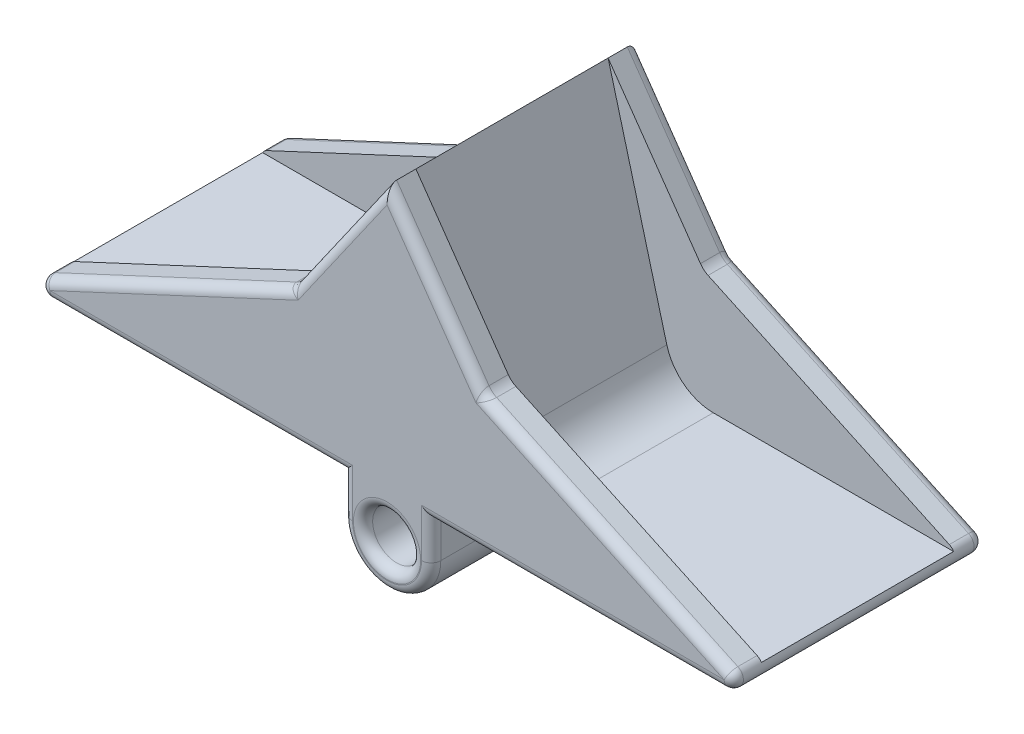
from build123d import *
from OCP.BRepAlgoAPI import BRepAlgoAPI_Cut
from OCP.TopTools import TopTools_ListOfShape

# Parameters (mm, degrees)
BOSS_EXTRUDE1_START = 54.459022
SKETCH1_R           = 3.175
BOSS_EXTRUDE1_DEPTH = 33.020001
CUT_EXTRUDE1_START  = 58.269023
CUT_EXTRUDE1_DEPTH  = 25.4
SKETCH4_R           = 3.048
CUT_EXTRUDE2_DEPTH  = 2.54
FILLET1_R           = 6.35
FILLET2_R           = 1.27
FILLET3_R           = 2.54


with BuildPart() as part:
    # Sketch1 → Boss-Extrude1 (new body)
    with BuildSketch(Plane.XY.offset(BOSS_EXTRUDE1_START)):
        with BuildLine():
            Line((-21.955663069, 32.913530589), (-66.405663069, 32.913530589))
            Line((-66.405663069, 32.913530589), (-28.719401239, 50.486923087))
            Line((-28.719401239, 50.486923087), (-16.12504308, 68.473530589))
            Line((-16.12504308, 68.473530589), (-3.530684921, 50.486923087))
            Line((-3.530684921, 50.486923087), (34.155576909, 32.913530589))
            Line((34.155576909, 32.913530589), (-10.294423091, 32.913530589))
            Line((-10.294423091, 32.913530589), (-10.294423091, 27.833530589))
            ThreePointArc((-10.294423091, 27.833530589), (-16.12504308, 22.002910599), (-21.955663069, 27.833530589))
            Line((-21.955663069, 27.833530589), (-21.955663069, 32.913530589))
        make_face()
        with Locations(Location((-16.12504308, 27.833530589, 0), (0, 0, 180))):
            Circle(SKETCH1_R, mode=Mode.SUBTRACT)
    extrude(amount=BOSS_EXTRUDE1_DEPTH)

    # Sketch2 → Cut-Extrude1 (cut)
    with BuildSketch(Plane.XY.offset(CUT_EXTRUDE1_START)):
        Polygon((-7.107213009, 34.818530589), (-16.12504308, 68.473530589), (-3.530684921, 50.486923087), (30.070291226, 34.818530589), align=None)
        Polygon((-25.142873151, 34.818530589), (-16.12504308, 68.473530589), (-28.719401239, 50.486923087), (-62.320377386, 34.818530589), align=None)
    extrude(amount=CUT_EXTRUDE1_DEPTH, mode=Mode.SUBTRACT)


with BuildPart() as cut_extrude2_tool:
    # Sketch4 → Cut-Extrude2 (new body)
    with BuildSketch(Plane(origin=(0, 0, 54.459022565), x_dir=(-1, 0, 0), z_dir=(0, 0, -1))):
        with Locations((16.12504308, 58.313530589)):
            Circle(SKETCH4_R)
    extrude(amount=-CUT_EXTRUDE2_DEPTH)


with BuildPart() as part_1:
    add(part.part)

    # Cut-Extrude2: cut by cut_extrude2_tool, with a tolerance
    cut_extrude2_stock = TopTools_ListOfShape()
    cut_extrude2_stock.Append(part_1.part.wrapped)
    cut_extrude2_tools = TopTools_ListOfShape()
    cut_extrude2_tools.Append(cut_extrude2_tool.part.wrapped)
    cut_extrude2_cut = BRepAlgoAPI_Cut()
    cut_extrude2_cut.SetArguments(cut_extrude2_stock)
    cut_extrude2_cut.SetTools(cut_extrude2_tools)
    cut_extrude2_cut.SetFuzzyValue(0.00001)
    cut_extrude2_cut.Build()
    add(Compound.cast(cut_extrude2_cut.Shape()).solids(), mode=Mode.REPLACE)

    # Fillet1
    fillet1_edges = [part_1.edges().sort_by_distance(p)[0] for p in [
        (-25.142873151, 34.818530589, 70.969023),
        (-7.107213009, 34.818530589, 70.969023),
    ]]
    fillet(fillet1_edges, radius=FILLET1_R)

    # Fillet2
    # the kernel refuses this fillet: 1.27 mm, written as the material it takes off along each edge
    with BuildSketch(Plane(origin=(28.42697711, 34.183530589, 55.729022), x_dir=(0.21643961393809957, 0.9762960071199341, 0), z_dir=(0.38783998848387446, -0.08598205540637287, -0.9177075947604028))) as fillet2_piece_1_section:
        Polygon((-7.204264304, -7.204264304), (7.204264304, -7.204264304), (7.204264304, 7.204264304), (-7.204264304, 7.204264304), align=None)
    fillet2_piece_1 = extrude(amount=7.204264304, mode=Mode.PRIVATE)
    fillet2_piece_1 = split(fillet2_piece_1, bisect_by=Plane(origin=(28.42697711, 34.183530589, 55.729022), z_dir=(1, 0, 0)), keep=Keep.TOP, mode=Mode.PRIVATE)
    fillet2_piece_1 = split(fillet2_piece_1, bisect_by=Plane(origin=(28.42697711, 34.183530589, 55.729022), z_dir=(0, 0, -1)), keep=Keep.TOP, mode=Mode.PRIVATE)
    fillet2_piece_1 = split(fillet2_piece_1, bisect_by=Plane(origin=(28.42697711, 34.183530589, 55.729022), z_dir=(0.9063077870366527, -0.42261826174069367, 0)), keep=Keep.TOP, mode=Mode.PRIVATE)
    fillet2_piece_1 = split(fillet2_piece_1, bisect_by=Plane(origin=(28.42697711, 34.183530589, 54.459022), z_dir=(0, 0, 1)), keep=Keep.TOP, mode=Mode.PRIVATE)
    fillet2_piece_1 = split(fillet2_piece_1, bisect_by=Plane(origin=(28.42697711, 32.913530589, 55.729022), z_dir=(0, 1, 0)), keep=Keep.TOP, mode=Mode.PRIVATE)
    fillet2_piece_1 = split(fillet2_piece_1, bisect_by=Plane(origin=(28.963702302, 35.334541478, 55.729022), z_dir=(-0.42261826174069367, -0.9063077870366527, 0)), keep=Keep.TOP, mode=Mode.PRIVATE)
    fillet2_piece_1 = fillet2_piece_1 - Plane(origin=(28.42697711, 34.183530589, 55.729022), x_dir=(-0.38783998848387446, 0.08598205540637287, 0.9177075947604028), z_dir=(0.21643961393809957, 0.9762960071199341, 0)) * Sphere(FILLET2_R, mode=Mode.PRIVATE)
    with BuildSketch(Plane(origin=(-60.67706327, 34.183530589, 55.729022), x_dir=(0.2164396139380998, -0.976296007119934, 0), z_dir=(-0.38783998848387446, -0.08598205540637296, -0.9177075947604028))) as fillet2_piece_2_section:
        Polygon((-7.204264304, -7.204264304), (7.204264304, -7.204264304), (7.204264304, 7.204264304), (-7.204264304, 7.204264304), align=None)
    fillet2_piece_2 = extrude(amount=7.204264304, mode=Mode.PRIVATE)
    fillet2_piece_2 = split(fillet2_piece_2, bisect_by=Plane(origin=(-60.67706327, 34.183530589, 55.729022), z_dir=(-1, 0, 0)), keep=Keep.TOP, mode=Mode.PRIVATE)
    fillet2_piece_2 = split(fillet2_piece_2, bisect_by=Plane(origin=(-60.67706327, 34.183530589, 55.729022), z_dir=(0, 0, -1)), keep=Keep.TOP, mode=Mode.PRIVATE)
    fillet2_piece_2 = split(fillet2_piece_2, bisect_by=Plane(origin=(-60.67706327, 34.183530589, 55.729022), z_dir=(-0.9063077870366526, -0.422618261740694, 0)), keep=Keep.TOP, mode=Mode.PRIVATE)
    fillet2_piece_2 = split(fillet2_piece_2, bisect_by=Plane(origin=(-60.67706327, 34.183530589, 54.459022), z_dir=(0, 0, 1)), keep=Keep.TOP, mode=Mode.PRIVATE)
    fillet2_piece_2 = split(fillet2_piece_2, bisect_by=Plane(origin=(-60.67706327, 32.913530589, 55.729022), z_dir=(0, 1, 0)), keep=Keep.TOP, mode=Mode.PRIVATE)
    fillet2_piece_2 = split(fillet2_piece_2, bisect_by=Plane(origin=(-61.213788462, 35.334541478, 55.729022), z_dir=(0.422618261740694, -0.9063077870366526, 0)), keep=Keep.TOP, mode=Mode.PRIVATE)
    fillet2_piece_2 = fillet2_piece_2 - Plane(origin=(-60.67706327, 34.183530589, 55.729022), x_dir=(0.38783998848387446, 0.08598205540637296, 0.9177075947604028), z_dir=(0.2164396139380998, -0.976296007119934, 0)) * Sphere(FILLET2_R, mode=Mode.PRIVATE)
    with BuildSketch(Plane(origin=(-60.67706327, 34.183530589, 86.209023), x_dir=(-0.2164396139380998, 0.976296007119934, 0), z_dir=(-0.38783998848387446, -0.08598205540637296, 0.9177075947604028))) as fillet2_piece_3_section:
        Polygon((-7.204264304, -7.204264304), (7.204264304, -7.204264304), (7.204264304, 7.204264304), (-7.204264304, 7.204264304), align=None)
    fillet2_piece_3 = extrude(amount=7.204264304, mode=Mode.PRIVATE)
    fillet2_piece_3 = split(fillet2_piece_3, bisect_by=Plane(origin=(-60.67706327, 34.183530589, 86.209023), z_dir=(-1, 0, 0)), keep=Keep.TOP, mode=Mode.PRIVATE)
    fillet2_piece_3 = split(fillet2_piece_3, bisect_by=Plane(origin=(-60.67706327, 34.183530589, 86.209023), z_dir=(0, 0, 1)), keep=Keep.TOP, mode=Mode.PRIVATE)
    fillet2_piece_3 = split(fillet2_piece_3, bisect_by=Plane(origin=(-60.67706327, 34.183530589, 86.209023), z_dir=(-0.9063077870366526, -0.422618261740694, 0)), keep=Keep.TOP, mode=Mode.PRIVATE)
    fillet2_piece_3 = split(fillet2_piece_3, bisect_by=Plane(origin=(-60.67706327, 34.183530589, 87.479023), z_dir=(0, 0, -1)), keep=Keep.TOP, mode=Mode.PRIVATE)
    fillet2_piece_3 = split(fillet2_piece_3, bisect_by=Plane(origin=(-60.67706327, 32.913530589, 86.209023), z_dir=(0, 1, 0)), keep=Keep.TOP, mode=Mode.PRIVATE)
    fillet2_piece_3 = split(fillet2_piece_3, bisect_by=Plane(origin=(-61.213788462, 35.334541478, 86.209023), z_dir=(0.422618261740694, -0.9063077870366526, 0)), keep=Keep.TOP, mode=Mode.PRIVATE)
    fillet2_piece_3 = fillet2_piece_3 - Plane(origin=(-60.67706327, 34.183530589, 86.209023), x_dir=(0.38783998848387446, 0.08598205540637296, -0.9177075947604028), z_dir=(-0.2164396139380998, 0.976296007119934, 0)) * Sphere(FILLET2_R, mode=Mode.PRIVATE)
    with BuildSketch(Plane(origin=(28.42697711, 34.183530589, 86.209023), x_dir=(0.9211187870387684, 0, -0.3892816206350206), z_dir=(0.38783998848387446, -0.08598205540637287, 0.9177075947604028))) as fillet2_piece_4_section:
        Polygon((-7.204264304, -7.204264304), (7.204264304, -7.204264304), (7.204264304, 7.204264304), (-7.204264304, 7.204264304), align=None)
    fillet2_piece_4 = extrude(amount=7.204264304, mode=Mode.PRIVATE)
    fillet2_piece_4 = split(fillet2_piece_4, bisect_by=Plane(origin=(28.42697711, 34.183530589, 86.209023), z_dir=(1, 0, 0)), keep=Keep.TOP, mode=Mode.PRIVATE)
    fillet2_piece_4 = split(fillet2_piece_4, bisect_by=Plane(origin=(28.42697711, 34.183530589, 86.209023), z_dir=(0.9063077870366527, -0.42261826174069367, 0)), keep=Keep.TOP, mode=Mode.PRIVATE)
    fillet2_piece_4 = split(fillet2_piece_4, bisect_by=Plane(origin=(28.42697711, 34.183530589, 86.209023), z_dir=(0, 0, 1)), keep=Keep.TOP, mode=Mode.PRIVATE)
    fillet2_piece_4 = split(fillet2_piece_4, bisect_by=Plane(origin=(28.42697711, 32.913530589, 86.209023), z_dir=(0, 1, 0)), keep=Keep.TOP, mode=Mode.PRIVATE)
    fillet2_piece_4 = split(fillet2_piece_4, bisect_by=Plane(origin=(28.42697711, 34.183530589, 87.479023), z_dir=(0, 0, -1)), keep=Keep.TOP, mode=Mode.PRIVATE)
    fillet2_piece_4 = split(fillet2_piece_4, bisect_by=Plane(origin=(28.963702302, 35.334541478, 86.209023), z_dir=(-0.42261826174069367, -0.9063077870366527, 0)), keep=Keep.TOP, mode=Mode.PRIVATE)
    fillet2_piece_4 = fillet2_piece_4 - Plane(origin=(28.42697711, 34.183530589, 86.209023), x_dir=(-0.38783998848387446, 0.08598205540637287, -0.9177075947604028), z_dir=(0.9211187870387684, 0, -0.3892816206350206)) * Sphere(FILLET2_R, mode=Mode.PRIVATE)
    with BuildSketch(Plane(origin=(-16.12504308, 27.833530589, 54.459022), x_dir=(-1, 0, 0), z_dir=(0, 1, 0))) as fillet2_piece_5:
        with BuildLine():
            CenterArc((3.175 + FILLET2_R, FILLET2_R), FILLET2_R, 180, 90)
            Line((3.175, FILLET2_R), (3.175, 0))
            Line((3.175, 0), (3.175 + FILLET2_R, 0))
        make_face()
    fillet2_piece_5_solid = revolve(axis=Axis((-16.12504308, 27.833530589, 54.459022), (0, 0, 1)), mode=Mode.PRIVATE)
    with BuildSketch(Plane(origin=(-10.294423091, 32.913530589, 54.459022), x_dir=(-1, 0, 0), z_dir=(0, -1, 0)), Plane(origin=(-21.955663069, 27.833530589, 54.459022), x_dir=(1, 0, 0), z_dir=(0, 1, 0))) as fillet2_piece_6:
        with BuildLine():
            CenterArc((FILLET2_R, -FILLET2_R), FILLET2_R, 90, 90)
            Line((0, -FILLET2_R), (0, 0))
            Line((0, 0), (FILLET2_R, 0))
        make_face()
    fillet2_piece_6_solid = extrude(amount=5.08, mode=Mode.PRIVATE)
    with BuildSketch(Plane(origin=(28.42697711, 32.913530589, 54.459022), x_dir=(0, 1, 0), z_dir=(-1, 0, 0)), Plane(origin=(-21.955663069, 32.913530589, 54.459022), x_dir=(0, 1, 0), z_dir=(-1, 0, 0))) as fillet2_piece_7:
        with BuildLine():
            CenterArc((FILLET2_R, -FILLET2_R), FILLET2_R, 90, 90)
            Line((0, -FILLET2_R), (0, 0))
            Line((0, 0), (FILLET2_R, 0))
        make_face()
    fillet2_piece_7_solid = extrude(amount=38.7214002, mode=Mode.PRIVATE)
    with BuildSketch(Plane(origin=(-6.408212144, 51.828736068, 54.459022), x_dir=(-0.42261826174069367, -0.9063077870366527, 0), z_dir=(0.9063077870366527, -0.42261826174069367, 0))) as fillet2_piece_8_section:
        with BuildLine():
            CenterArc((FILLET2_R, -FILLET2_R), FILLET2_R, 90, 90)
            Line((0, -FILLET2_R), (0, 0))
            Line((0, 0), (FILLET2_R, 0))
        make_face()
    fillet2_piece_8 = extrude(amount=39.028589352, mode=Mode.PRIVATE)
    fillet2_piece_8 = split(fillet2_piece_8, bisect_by=Plane(origin=(-5.107808274, 52.739288661, 54.459022), z_dir=(0.819152044288989, 0.5735764363510499, 0)), keep=Keep.TOP, mode=Mode.PRIVATE)
    with BuildSketch(Plane(origin=(-17.946148265, 71.074338329, 54.459022), x_dir=(-0.8191520442889889, -0.57357643635105, 0), z_dir=(0.57357643635105, -0.8191520442889891, 0))) as fillet2_piece_9_section:
        with BuildLine():
            CenterArc((FILLET2_R, -FILLET2_R), FILLET2_R, 90, 90)
            Line((0, -FILLET2_R), (0, 0))
            Line((0, 0), (FILLET2_R, 0))
        make_face()
    fillet2_piece_9 = extrude(amount=28.307593376, mode=Mode.PRIVATE)
    fillet2_piece_9 = split(fillet2_piece_9, bisect_by=Plane(origin=(-23.256894728, 59.685405787, 54.459022), z_dir=(0.42261826174069367, 0.9063077870366527, 0)), keep=Keep.TOP, mode=Mode.PRIVATE)
    with BuildSketch(Plane(origin=(-30.540506425, 47.886115346, 54.459022), x_dir=(0, 0, 1), z_dir=(0.5735764363510499, 0.8191520442889892, 0))) as fillet2_piece_10_section:
        with BuildLine():
            CenterArc((FILLET2_R, FILLET2_R), FILLET2_R, 180, 90)
            Line((0, FILLET2_R), (0, 0))
            Line((0, 0), (FILLET2_R, 0))
        make_face()
    fillet2_piece_10 = extrude(amount=28.307593376, mode=Mode.PRIVATE)
    fillet2_piece_10 = split(fillet2_piece_10, bisect_by=Plane(origin=(-31.211412915, 49.324878958, 54.459022), z_dir=(-0.422618261740694, 0.9063077870366526, 0)), keep=Keep.TOP, mode=Mode.PRIVATE)
    with BuildSketch(Plane(origin=(-61.213788462, 35.334541478, 54.459022), x_dir=(0, 0, 1), z_dir=(0.9063077870366526, 0.422618261740694, 0))) as fillet2_piece_11_section:
        with BuildLine():
            CenterArc((FILLET2_R, FILLET2_R), FILLET2_R, 180, 90)
            Line((0, FILLET2_R), (0, 0))
            Line((0, 0), (FILLET2_R, 0))
        make_face()
    fillet2_piece_11 = extrude(amount=39.028589352, mode=Mode.PRIVATE)
    fillet2_piece_11 = split(fillet2_piece_11, bisect_by=Plane(origin=(-46.529017956, 25.052154473, 54.459022), z_dir=(-0.8191520442889892, 0.5735764363510499, 0)), keep=Keep.TOP, mode=Mode.PRIVATE)
    with BuildSketch(Plane(origin=(-16.12504308, 27.833530589, 54.459022), x_dir=(1, 0, 0), z_dir=(0, 1, 0))) as fillet2_piece_12:
        with BuildLine():
            CenterArc((5.830619989 - FILLET2_R, -FILLET2_R), FILLET2_R, 0, 90)
            Line((5.830619989, -FILLET2_R), (5.830619989, 0))
            Line((5.830619989, 0), (5.830619989 - FILLET2_R, 0))
        make_face()
    fillet2_piece_12_solid = revolve(axis=Axis((-16.12504308, 27.833530589, 54.459022), (0, 0, -1)), revolution_arc=180, mode=Mode.PRIVATE)
    with BuildSketch(Plane(origin=(-21.955663069, 32.913530589, 87.479023), x_dir=(0, 1, 0), z_dir=(-1, 0, 0)), Plane(origin=(28.42697711, 32.913530589, 87.479023), x_dir=(0, 1, 0), z_dir=(-1, 0, 0))) as fillet2_piece_13:
        with BuildLine():
            CenterArc((FILLET2_R, FILLET2_R), FILLET2_R, 180, 90)
            Line((0, FILLET2_R), (0, 0))
            Line((0, 0), (FILLET2_R, 0))
        make_face()
    fillet2_piece_13_solid = extrude(amount=38.7214002, mode=Mode.PRIVATE)
    with BuildSketch(Plane(origin=(-61.213788462, 35.334541478, 87.479023), x_dir=(0, 0, -1), z_dir=(0.9063077870366526, 0.422618261740694, 0))) as fillet2_piece_14_section:
        with BuildLine():
            CenterArc((FILLET2_R, -FILLET2_R), FILLET2_R, 90, 90)
            Line((0, -FILLET2_R), (0, 0))
            Line((0, 0), (FILLET2_R, 0))
        make_face()
    fillet2_piece_14 = extrude(amount=39.028589352, mode=Mode.PRIVATE)
    fillet2_piece_14 = split(fillet2_piece_14, bisect_by=Plane(origin=(-46.529017956, 25.052154473, 87.479023), z_dir=(-0.8191520442889892, 0.5735764363510499, 0)), keep=Keep.TOP, mode=Mode.PRIVATE)
    with BuildSketch(Plane(origin=(-30.540506425, 47.886115346, 87.479023), x_dir=(0, 0, -1), z_dir=(0.5735764363510499, 0.8191520442889892, 0))) as fillet2_piece_15_section:
        with BuildLine():
            CenterArc((FILLET2_R, -FILLET2_R), FILLET2_R, 90, 90)
            Line((0, -FILLET2_R), (0, 0))
            Line((0, 0), (FILLET2_R, 0))
        make_face()
    fillet2_piece_15 = extrude(amount=28.307593376, mode=Mode.PRIVATE)
    fillet2_piece_15 = split(fillet2_piece_15, bisect_by=Plane(origin=(-31.211412915, 49.324878958, 87.479023), z_dir=(-0.422618261740694, 0.9063077870366526, 0)), keep=Keep.TOP, mode=Mode.PRIVATE)
    with BuildSketch(Plane(origin=(-17.946148265, 71.074338329, 87.479023), x_dir=(-0.819152044288989, -0.5735764363510499, 0), z_dir=(0.57357643635105, -0.8191520442889891, 0))) as fillet2_piece_16_section:
        with BuildLine():
            CenterArc((FILLET2_R, FILLET2_R), FILLET2_R, 180, 90)
            Line((0, FILLET2_R), (0, 0))
            Line((0, 0), (FILLET2_R, 0))
        make_face()
    fillet2_piece_16 = extrude(amount=28.307593376, mode=Mode.PRIVATE)
    fillet2_piece_16 = split(fillet2_piece_16, bisect_by=Plane(origin=(-23.256894728, 59.685405787, 87.479023), z_dir=(0.42261826174069367, 0.9063077870366527, 0)), keep=Keep.TOP, mode=Mode.PRIVATE)
    with BuildSketch(Plane(origin=(-6.408212144, 51.828736068, 87.479023), x_dir=(-0.42261826174069367, -0.9063077870366527, 0), z_dir=(0.9063077870366527, -0.42261826174069367, 0))) as fillet2_piece_17_section:
        with BuildLine():
            CenterArc((FILLET2_R, FILLET2_R), FILLET2_R, 180, 90)
            Line((0, FILLET2_R), (0, 0))
            Line((0, 0), (FILLET2_R, 0))
        make_face()
    fillet2_piece_17 = extrude(amount=39.028589352, mode=Mode.PRIVATE)
    fillet2_piece_17 = split(fillet2_piece_17, bisect_by=Plane(origin=(-5.107808274, 52.739288661, 87.479023), z_dir=(0.819152044288989, 0.5735764363510499, 0)), keep=Keep.TOP, mode=Mode.PRIVATE)
    with BuildSketch(Plane(origin=(-10.294423091, 32.913530589, 87.479023), x_dir=(-1, 0, 0), z_dir=(0, -1, 0)), Plane(origin=(-21.955663069, 27.833530589, 87.479023), x_dir=(1, 0, 0), z_dir=(0, 1, 0))) as fillet2_piece_18:
        with BuildLine():
            CenterArc((FILLET2_R, FILLET2_R), FILLET2_R, 180, 90)
            Line((0, FILLET2_R), (0, 0))
            Line((0, 0), (FILLET2_R, 0))
        make_face()
    fillet2_piece_18_solid = extrude(amount=5.08, mode=Mode.PRIVATE)
    with BuildSketch(Plane(origin=(-16.12504308, 27.833530589, 87.479023), x_dir=(1, 0, 0), z_dir=(0, 1, 0))) as fillet2_piece_19:
        with BuildLine():
            CenterArc((5.830619989 - FILLET2_R, FILLET2_R), FILLET2_R, 270, 90)
            Line((5.830619989, FILLET2_R), (5.830619989, 0))
            Line((5.830619989, 0), (5.830619989 - FILLET2_R, 0))
        make_face()
    fillet2_piece_19_solid = revolve(axis=Axis((-16.12504308, 27.833530589, 87.479023), (0, 0, -1)), revolution_arc=180, mode=Mode.PRIVATE)
    with BuildSketch(Plane(origin=(-16.12504308, 27.833530589, 87.479023), x_dir=(-1, 0, 0), z_dir=(0, 1, 0))) as fillet2_piece_20:
        with BuildLine():
            CenterArc((3.175 + FILLET2_R, -FILLET2_R), FILLET2_R, 90, 90)
            Line((3.175, -FILLET2_R), (3.175, 0))
            Line((3.175, 0), (3.175 + FILLET2_R, 0))
        make_face()
    fillet2_piece_20_solid = revolve(axis=Axis((-16.12504308, 27.833530589, 87.479023), (0, 0, 1)), mode=Mode.PRIVATE)
    with BuildSketch(Plane(origin=(34.155576909, 32.913530589, 55.729022), x_dir=(-1, 0, 0), z_dir=(0, 0, 1)), Plane(origin=(-66.405663069, 32.913530589, 55.729022), x_dir=(0.9063077870366528, 0.4226182617406935, 0), z_dir=(0, 0, 1))) as fillet2_piece_21:
        with BuildLine():
            CenterArc((FILLET2_R * 4.51070850366, -FILLET2_R), FILLET2_R, 90, 155)
            Line((FILLET2_R * 4.08809024192, -FILLET2_R * 1.90630778704), (0, 0))
            Line((0, 0), (FILLET2_R * 4.51070850366, 0))
        make_face()
    fillet2_piece_21_solid = extrude(amount=30.480001, mode=Mode.PRIVATE)
    with BuildSketch(Plane(origin=(-10.294423091, 36.088530589, 54.459022), x_dir=(-1, 0, 0), z_dir=(0, -1, 0))) as fillet2_piece_22a_section:
        with BuildLine():
            CenterArc((FILLET2_R, -FILLET2_R), FILLET2_R, 90, 90)
            Line((0, -FILLET2_R), (0, 0))
            Line((0, 0), (FILLET2_R, 0))
        make_face()
    fillet2_piece_22a = extrude(amount=8.255, mode=Mode.PRIVATE)
    fillet2_piece_22a = split(fillet2_piece_22a, bisect_by=Plane(origin=(-10.294423091, 32.913530589, 54.459022), z_dir=(0, 1, 0)), keep=Keep.TOP, mode=Mode.PRIVATE)
    with BuildSketch(Plane(origin=(28.42697711, 32.913530589, 54.459022), x_dir=(0, 1, 0), z_dir=(-1, 0, 0))) as fillet2_piece_22b_section:
        with BuildLine():
            CenterArc((FILLET2_R, -FILLET2_R), FILLET2_R, 90, 90)
            Line((0, -FILLET2_R), (0, 0))
            Line((0, 0), (FILLET2_R, 0))
        make_face()
    fillet2_piece_22b = extrude(amount=41.8964002, mode=Mode.PRIVATE)
    fillet2_piece_22b = split(fillet2_piece_22b, bisect_by=Plane(origin=(-10.294423091, 32.913530589, 54.459022), z_dir=(-1, 0, 0)), keep=Keep.TOP, mode=Mode.PRIVATE)
    fillet2_piece_22 = fillet2_piece_22a & fillet2_piece_22b
    with BuildSketch(Plane(origin=(-17.946148265, 71.074338329, 54.459022), x_dir=(-0.8191520442889889, -0.57357643635105, 0), z_dir=(0.57357643635105, -0.8191520442889891, 0))) as fillet2_piece_23a_section:
        with BuildLine():
            CenterArc((FILLET2_R, -FILLET2_R), FILLET2_R, 90, 90)
            Line((0, -FILLET2_R), (0, 0))
            Line((0, 0), (FILLET2_R, 0))
        make_face()
    fillet2_piece_23a = extrude(amount=28.307593376, mode=Mode.PRIVATE)
    fillet2_piece_23a = split(fillet2_piece_23a, bisect_by=Plane(origin=(-23.256894728, 59.685405787, 54.459022), z_dir=(-0.42261826174069367, -0.9063077870366527, 0)), keep=Keep.TOP, mode=Mode.PRIVATE)
    with BuildSketch(Plane(origin=(-6.408212144, 51.828736068, 54.459022), x_dir=(-0.42261826174069367, -0.9063077870366527, 0), z_dir=(0.9063077870366527, -0.42261826174069367, 0))) as fillet2_piece_23b_section:
        with BuildLine():
            CenterArc((FILLET2_R, -FILLET2_R), FILLET2_R, 90, 90)
            Line((0, -FILLET2_R), (0, 0))
            Line((0, 0), (FILLET2_R, 0))
        make_face()
    fillet2_piece_23b = extrude(amount=39.028589352, mode=Mode.PRIVATE)
    fillet2_piece_23b = split(fillet2_piece_23b, bisect_by=Plane(origin=(-5.107808274, 52.739288661, 54.459022), z_dir=(-0.819152044288989, -0.5735764363510499, 0)), keep=Keep.TOP, mode=Mode.PRIVATE)
    fillet2_piece_23 = fillet2_piece_23a & fillet2_piece_23b
    with BuildSketch(Plane(origin=(-30.540506425, 47.886115346, 54.459022), x_dir=(0, 0, 1), z_dir=(0.5735764363510499, 0.8191520442889892, 0))) as fillet2_piece_24a_section:
        with BuildLine():
            CenterArc((FILLET2_R, FILLET2_R), FILLET2_R, 180, 90)
            Line((0, FILLET2_R), (0, 0))
            Line((0, 0), (FILLET2_R, 0))
        make_face()
    fillet2_piece_24a = extrude(amount=28.307593376, mode=Mode.PRIVATE)
    fillet2_piece_24a = split(fillet2_piece_24a, bisect_by=Plane(origin=(-31.211412915, 49.324878958, 54.459022), z_dir=(0.422618261740694, -0.9063077870366526, 0)), keep=Keep.TOP, mode=Mode.PRIVATE)
    with BuildSketch(Plane(origin=(-61.213788462, 35.334541478, 54.459022), x_dir=(0, 0, 1), z_dir=(0.9063077870366526, 0.422618261740694, 0))) as fillet2_piece_24b_section:
        with BuildLine():
            CenterArc((FILLET2_R, FILLET2_R), FILLET2_R, 180, 90)
            Line((0, FILLET2_R), (0, 0))
            Line((0, 0), (FILLET2_R, 0))
        make_face()
    fillet2_piece_24b = extrude(amount=39.028589352, mode=Mode.PRIVATE)
    fillet2_piece_24b = split(fillet2_piece_24b, bisect_by=Plane(origin=(-46.529017956, 25.052154473, 54.459022), z_dir=(0.8191520442889892, -0.5735764363510499, 0)), keep=Keep.TOP, mode=Mode.PRIVATE)
    fillet2_piece_24 = fillet2_piece_24a & fillet2_piece_24b
    with BuildSketch(Plane(origin=(-18.780663069, 32.913530589, 54.459022), x_dir=(0, 1, 0), z_dir=(-1, 0, 0))) as fillet2_piece_25a_section:
        with BuildLine():
            CenterArc((FILLET2_R, -FILLET2_R), FILLET2_R, 90, 90)
            Line((0, -FILLET2_R), (0, 0))
            Line((0, 0), (FILLET2_R, 0))
        make_face()
    fillet2_piece_25a = extrude(amount=41.8964002, mode=Mode.PRIVATE)
    fillet2_piece_25a = split(fillet2_piece_25a, bisect_by=Plane(origin=(-21.955663069, 32.913530589, 54.459022), z_dir=(1, 0, 0)), keep=Keep.TOP, mode=Mode.PRIVATE)
    with BuildSketch(Plane(origin=(-21.955663069, 27.833530589, 54.459022), x_dir=(1, 0, 0), z_dir=(0, 1, 0))) as fillet2_piece_25b_section:
        with BuildLine():
            CenterArc((FILLET2_R, -FILLET2_R), FILLET2_R, 90, 90)
            Line((0, -FILLET2_R), (0, 0))
            Line((0, 0), (FILLET2_R, 0))
        make_face()
    fillet2_piece_25b = extrude(amount=8.255, mode=Mode.PRIVATE)
    fillet2_piece_25b = split(fillet2_piece_25b, bisect_by=Plane(origin=(-21.955663069, 32.913530589, 54.459022), z_dir=(0, 1, 0)), keep=Keep.TOP, mode=Mode.PRIVATE)
    fillet2_piece_25 = fillet2_piece_25a & fillet2_piece_25b
    with BuildSketch(Plane(origin=(-18.780663069, 32.913530589, 87.479023), x_dir=(0, 1, 0), z_dir=(-1, 0, 0))) as fillet2_piece_26a_section:
        with BuildLine():
            CenterArc((FILLET2_R, FILLET2_R), FILLET2_R, 180, 90)
            Line((0, FILLET2_R), (0, 0))
            Line((0, 0), (FILLET2_R, 0))
        make_face()
    fillet2_piece_26a = extrude(amount=41.8964002, mode=Mode.PRIVATE)
    fillet2_piece_26a = split(fillet2_piece_26a, bisect_by=Plane(origin=(-21.955663069, 32.913530589, 87.479023), z_dir=(1, 0, 0)), keep=Keep.TOP, mode=Mode.PRIVATE)
    with BuildSketch(Plane(origin=(-21.955663069, 27.833530589, 87.479023), x_dir=(1, 0, 0), z_dir=(0, 1, 0))) as fillet2_piece_26b_section:
        with BuildLine():
            CenterArc((FILLET2_R, FILLET2_R), FILLET2_R, 180, 90)
            Line((0, FILLET2_R), (0, 0))
            Line((0, 0), (FILLET2_R, 0))
        make_face()
    fillet2_piece_26b = extrude(amount=8.255, mode=Mode.PRIVATE)
    fillet2_piece_26b = split(fillet2_piece_26b, bisect_by=Plane(origin=(-21.955663069, 32.913530589, 87.479023), z_dir=(0, 1, 0)), keep=Keep.TOP, mode=Mode.PRIVATE)
    fillet2_piece_26 = fillet2_piece_26a & fillet2_piece_26b
    with BuildSketch(Plane(origin=(-61.213788462, 35.334541478, 87.479023), x_dir=(0, 0, -1), z_dir=(0.9063077870366526, 0.422618261740694, 0))) as fillet2_piece_27a_section:
        with BuildLine():
            CenterArc((FILLET2_R, -FILLET2_R), FILLET2_R, 90, 90)
            Line((0, -FILLET2_R), (0, 0))
            Line((0, 0), (FILLET2_R, 0))
        make_face()
    fillet2_piece_27a = extrude(amount=39.028589352, mode=Mode.PRIVATE)
    fillet2_piece_27a = split(fillet2_piece_27a, bisect_by=Plane(origin=(-46.529017956, 25.052154473, 87.479023), z_dir=(0.8191520442889892, -0.5735764363510499, 0)), keep=Keep.TOP, mode=Mode.PRIVATE)
    with BuildSketch(Plane(origin=(-30.540506425, 47.886115346, 87.479023), x_dir=(0, 0, -1), z_dir=(0.5735764363510499, 0.8191520442889892, 0))) as fillet2_piece_27b_section:
        with BuildLine():
            CenterArc((FILLET2_R, -FILLET2_R), FILLET2_R, 90, 90)
            Line((0, -FILLET2_R), (0, 0))
            Line((0, 0), (FILLET2_R, 0))
        make_face()
    fillet2_piece_27b = extrude(amount=28.307593376, mode=Mode.PRIVATE)
    fillet2_piece_27b = split(fillet2_piece_27b, bisect_by=Plane(origin=(-31.211412915, 49.324878958, 87.479023), z_dir=(0.422618261740694, -0.9063077870366526, 0)), keep=Keep.TOP, mode=Mode.PRIVATE)
    fillet2_piece_27 = fillet2_piece_27a & fillet2_piece_27b
    with BuildSketch(Plane(origin=(-17.946148265, 71.074338329, 87.479023), x_dir=(-0.819152044288989, -0.5735764363510499, 0), z_dir=(0.57357643635105, -0.8191520442889891, 0))) as fillet2_piece_28a_section:
        with BuildLine():
            CenterArc((FILLET2_R, FILLET2_R), FILLET2_R, 180, 90)
            Line((0, FILLET2_R), (0, 0))
            Line((0, 0), (FILLET2_R, 0))
        make_face()
    fillet2_piece_28a = extrude(amount=28.307593376, mode=Mode.PRIVATE)
    fillet2_piece_28a = split(fillet2_piece_28a, bisect_by=Plane(origin=(-23.256894728, 59.685405787, 87.479023), z_dir=(-0.42261826174069367, -0.9063077870366527, 0)), keep=Keep.TOP, mode=Mode.PRIVATE)
    with BuildSketch(Plane(origin=(-6.408212144, 51.828736068, 87.479023), x_dir=(-0.42261826174069367, -0.9063077870366527, 0), z_dir=(0.9063077870366527, -0.42261826174069367, 0))) as fillet2_piece_28b_section:
        with BuildLine():
            CenterArc((FILLET2_R, FILLET2_R), FILLET2_R, 180, 90)
            Line((0, FILLET2_R), (0, 0))
            Line((0, 0), (FILLET2_R, 0))
        make_face()
    fillet2_piece_28b = extrude(amount=39.028589352, mode=Mode.PRIVATE)
    fillet2_piece_28b = split(fillet2_piece_28b, bisect_by=Plane(origin=(-5.107808274, 52.739288661, 87.479023), z_dir=(-0.819152044288989, -0.5735764363510499, 0)), keep=Keep.TOP, mode=Mode.PRIVATE)
    fillet2_piece_28 = fillet2_piece_28a & fillet2_piece_28b
    with BuildSketch(Plane(origin=(28.42697711, 32.913530589, 87.479023), x_dir=(0, 1, 0), z_dir=(-1, 0, 0))) as fillet2_piece_29a_section:
        with BuildLine():
            CenterArc((FILLET2_R, FILLET2_R), FILLET2_R, 180, 90)
            Line((0, FILLET2_R), (0, 0))
            Line((0, 0), (FILLET2_R, 0))
        make_face()
    fillet2_piece_29a = extrude(amount=41.8964002, mode=Mode.PRIVATE)
    fillet2_piece_29a = split(fillet2_piece_29a, bisect_by=Plane(origin=(-10.294423091, 32.913530589, 87.479023), z_dir=(-1, 0, 0)), keep=Keep.TOP, mode=Mode.PRIVATE)
    with BuildSketch(Plane(origin=(-10.294423091, 36.088530589, 87.479023), x_dir=(-1, 0, 0), z_dir=(0, -1, 0))) as fillet2_piece_29b_section:
        with BuildLine():
            CenterArc((FILLET2_R, FILLET2_R), FILLET2_R, 180, 90)
            Line((0, FILLET2_R), (0, 0))
            Line((0, 0), (FILLET2_R, 0))
        make_face()
    fillet2_piece_29b = extrude(amount=8.255, mode=Mode.PRIVATE)
    fillet2_piece_29b = split(fillet2_piece_29b, bisect_by=Plane(origin=(-10.294423091, 32.913530589, 87.479023), z_dir=(0, 1, 0)), keep=Keep.TOP, mode=Mode.PRIVATE)
    fillet2_piece_29 = fillet2_piece_29a & fillet2_piece_29b
    add([fillet2_piece_1, fillet2_piece_2, fillet2_piece_3, fillet2_piece_4, fillet2_piece_5_solid, fillet2_piece_6_solid, fillet2_piece_7_solid, fillet2_piece_8, fillet2_piece_9, fillet2_piece_10, fillet2_piece_11, fillet2_piece_12_solid, fillet2_piece_13_solid, fillet2_piece_14, fillet2_piece_15, fillet2_piece_16, fillet2_piece_17, fillet2_piece_18_solid, fillet2_piece_19_solid, fillet2_piece_20_solid, fillet2_piece_21_solid, fillet2_piece_22, fillet2_piece_23, fillet2_piece_24, fillet2_piece_25, fillet2_piece_26, fillet2_piece_27, fillet2_piece_28, fillet2_piece_29], mode=Mode.SUBTRACT)

    # Fillet3
    fillet3_edges = [part_1.edges().sort_by_distance(p)[0] for p in [
        (-28.719401239, 50.486923087, 84.939023),
        (-3.530684921, 50.486923087, 84.939023),
        (-3.783419305, 50.185725977, 87.114794285),
        (-3.783419485, 50.185725762, 54.823250449),
        (-28.466666675, 50.185725762, 87.114794551),
        (-28.466666675, 50.185725762, 54.823250449),
        (-28.719401239, 50.486923087, 56.9990225),
        (-3.530684921, 50.486923087, 56.9990225),
    ]]
    fillet(fillet3_edges, radius=FILLET3_R)


solid = part_1.part
